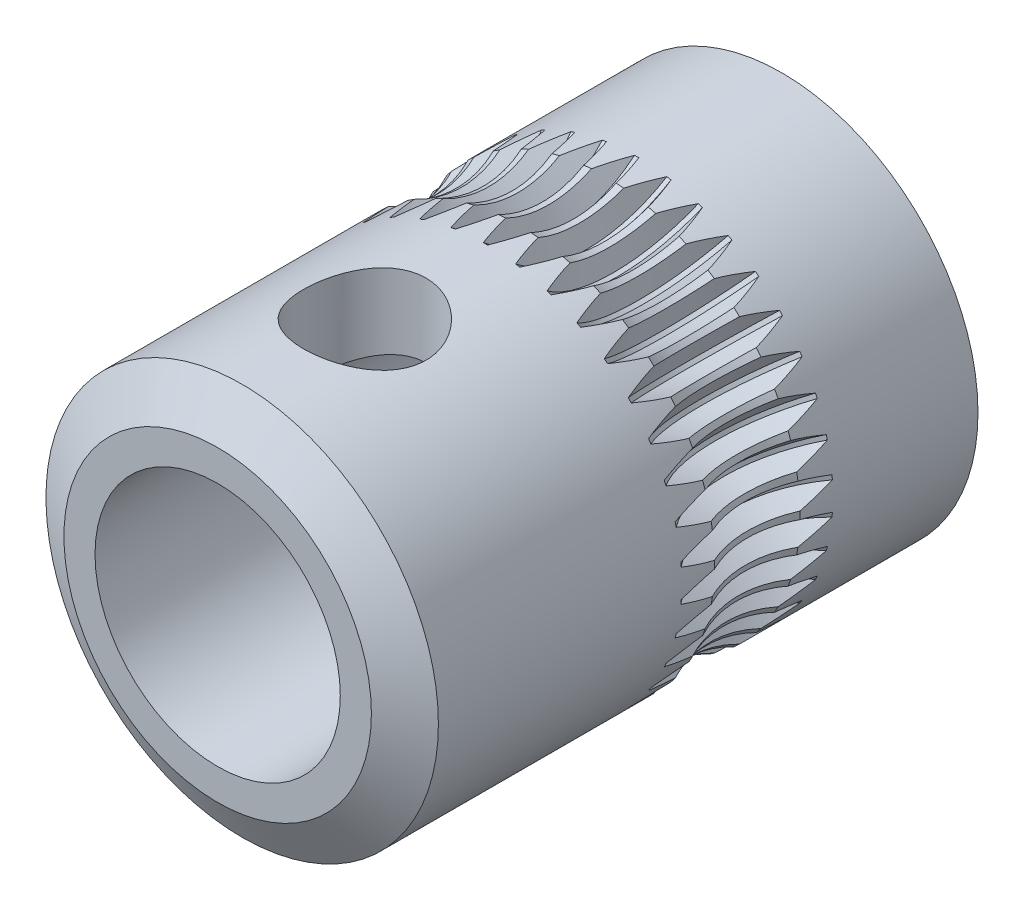
from build123d import *

# Parameters (mm, degrees)
SKETCH1_R           = 4
SKETCH1_R_2         = 2.5
BOSS_EXTRUDE1_DEPTH = 12
CHAMFER1_SIZE       = 0.5
CHAMFER1_SIZE2      = 0.866025404
SKETCH2_R           = 2
CIRPATTERN1_COUNT   = 38
CHAMFER2_SIZE       = 0.5
CHAMFER2_SIZE2      = 0.866025404
SKETCH4_W           = 1.25
SKETCH4_H           = 4.104655048


with BuildPart() as part:
    # Sketch1 → Boss-Extrude1 (new body)
    with BuildSketch(Plane.XY):
        Circle(SKETCH1_R)
        Circle(SKETCH1_R_2, mode=Mode.SUBTRACT)
    extrude(amount=BOSS_EXTRUDE1_DEPTH)

    # Chamfer1
    chamfer1_edges = [part.edges().sort_by_distance(p)[0] for p in [
        (-4, 0, 12),
    ]]
    chamfer1_side = [part.faces().sort_by_distance(p)[0] for p in [
        (-4, 0, 6),
    ]]
    chamfer(chamfer1_edges, length=CHAMFER1_SIZE, length2=CHAMFER1_SIZE2, reference=chamfer1_side[0])

    # Sketch2 → Cut-Revolve1 (revolve, cut)
    with BuildSketch(Plane(origin=(0, 0, 0), x_dir=(0, 0, -1), z_dir=(1, 0, 0))):
        with Locations((-5, 5.8)):
            Circle(SKETCH2_R)
    revolve(axis=Axis((0, 0, 0), (0, 0, 1)), mode=Mode.SUBTRACT)

    # Sketch3 → Cut-Revolve2 (revolve, cut)
    with BuildSketch(Plane(origin=(3.2, 0, 5), x_dir=(1, 0, 0), z_dir=(0, 0, 1))):
        Polygon((-3.24375, 3.43), (-3.15625, 3.43), (-2.9426304, 3.8), (-2.151071718, 3.8), (-2.151071718, 4.39756734), (-4.248928282, 4.39756734), (-4.248928282, 3.8), (-3.4573696, 3.8), align=None)
    cut_revolve2 = revolve(axis=Axis((-1.842545421, 5.8, 5), (1, 0, 0)), mode=Mode.SUBTRACT)

    # CirPattern1: Cut-Revolve2 ×38 about axis
    cirpattern1_axis = Axis((0, 0, 12), (0, 0, -1))
    for i in range(1, CIRPATTERN1_COUNT):
        add(cut_revolve2.rotate(cirpattern1_axis, i * 360 / CIRPATTERN1_COUNT), mode=Mode.SUBTRACT)

    # Chamfer2
    chamfer2_edges = [part.edges().sort_by_distance(p)[0] for p in [
        (-4, 0, 0),
    ]]
    chamfer2_side = [part.faces().sort_by_distance(p)[0] for p in [
        (-4, 0, 2.064110106),
    ]]
    chamfer(chamfer2_edges, length=CHAMFER2_SIZE, length2=CHAMFER2_SIZE2, reference=chamfer2_side[0])

    # Sketch4 → M3 Tapped Hole1 (revolve, cut)
    with BuildSketch(Plane(origin=(0, 0, 9), x_dir=(0, 0, -1), z_dir=(1, 0, 0))):
        with Locations((0.625, 2.052327524)):
            Rectangle(SKETCH4_W, SKETCH4_H)
    revolve(axis=Axis((0, -6.35, 9), (0, 1, 0)), mode=Mode.SUBTRACT)


solid = part.part
